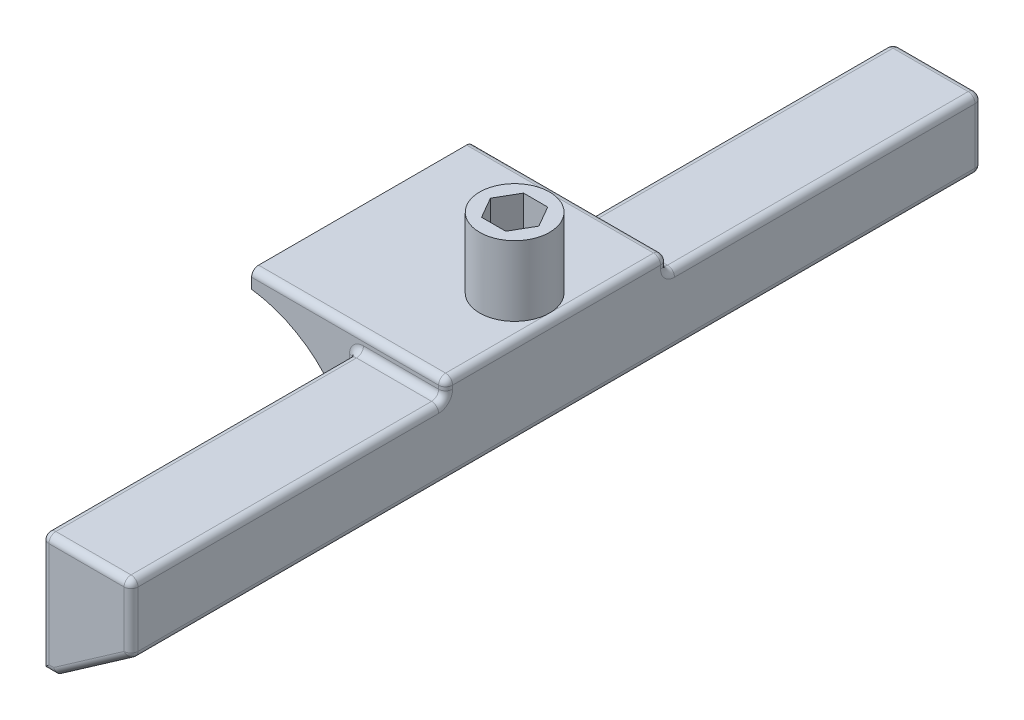
from build123d import *

# Parameters (mm, degrees)
SKETCH1_W                         = 25.5
SKETCH1_H                         = 243.5
SKETCH1_W_2                       = 17.5
SKETCH1_H_2                       = 235.5
MOTOR_PANEL_CONNECTOR_DEPTH       = 34
SKETCH3_W                         = 25.5
SKETCH3_H                         = 243.5
MOTOR_PANEL_CONNECCTOR_BASE_DEPTH = 4
UP_DOWN_CONNECT_CUT_DEPTH         = 250
SKETCH5_W                         = 47.5
SKETCH5_H                         = 31
CUT_TO_NAIL_PART_DEPTH            = 5
SKETCH6_W                         = 55.5
SKETCH6_H                         = 63.5
PANEL_CONNECTOR_DEPTH             = 5
SKETCH7_R                         = 10
BOSS_EXTRUDE4_DEPTH               = 20
BOSS_EXTRUDE5_DEPTH               = 5
BOSS_EXTRUDE6_DEPTH               = 5
FILLET1_R                         = 2


with BuildPart() as part:
    # Sketch1 → motor -panel connector (new body)
    with BuildSketch(Plane(origin=(0, 0, 0), x_dir=(1, 0, 0), z_dir=(0, 1, 0))):
        with Locations((8.75, -117.75)):
            Rectangle(SKETCH1_W, SKETCH1_H)
        with Locations((8.75, -117.75)):
            Rectangle(SKETCH1_W_2, SKETCH1_H_2, mode=Mode.SUBTRACT)
    extrude(amount=MOTOR_PANEL_CONNECTOR_DEPTH)

    # Sketch3 → motor-panel connecctor base (add)
    with BuildSketch(Plane(origin=(0, 34, 0), x_dir=(1, 0, 0), z_dir=(0, 1, 0))):
        with Locations((8.75, -117.75)):
            Rectangle(SKETCH3_W, SKETCH3_H)
    extrude(amount=-MOTOR_PANEL_CONNECCTOR_BASE_DEPTH)

    # Sketch4 → up down connect cut (cut)
    with BuildSketch(Plane.XY.offset(239.5)):
        Polygon((0, 0), (21.5, 15), (21.5, 0), align=None)
    extrude(amount=-UP_DOWN_CONNECT_CUT_DEPTH, mode=Mode.SUBTRACT)

    # Sketch5 → cut to nail part (cut)
    with BuildSketch(Plane.ZY.offset(4)):
        with Locations((117.75, 15.5)):
            Rectangle(SKETCH5_W, SKETCH5_H)
    extrude(amount=-CUT_TO_NAIL_PART_DEPTH, mode=Mode.SUBTRACT)

    # Sketch6 → panel connector (add)
    with BuildSketch(Plane(origin=(0, 34, 0), x_dir=(1, 0, 0), z_dir=(0, 1, 0))):
        with Locations((-6.25, -117.75)):
            Rectangle(SKETCH6_W, SKETCH6_H)
    extrude(amount=PANEL_CONNECTOR_DEPTH)

    # Sketch7 → Boss-Extrude4 (add)
    with BuildSketch(Plane(origin=(0, 39, 0), x_dir=(1, 0, 0), z_dir=(0, 1, 0))):
        with Locations(Location((9.5, -117.75, 0), (0, 0, 90))):
            Circle(SKETCH7_R)
        Polygon((12.964101615, -123.75), (16.42820323, -117.75), (12.964101615, -111.75), (6.035898385, -111.75), (2.57179677, -117.75), (6.035898385, -123.75), align=None, mode=Mode.SUBTRACT)
    extrude(amount=BOSS_EXTRUDE4_DEPTH)

    # Sketch8 → Boss-Extrude5 (add)
    with BuildSketch(Plane.XY.offset(149.5)):
        with BuildLine():
            Line((-34, 34), (-4, 34))
            Line((-4, 34), (-4, 0))
            ThreePointArc((-4, 0), (-12.572222823, 22.671568098), (-34, 34))
        make_face()
    extrude(amount=-BOSS_EXTRUDE5_DEPTH)

    # Sketch13 → Boss-Extrude6 (add)
    with BuildSketch(Plane(origin=(0, 0, 86), x_dir=(-1, 0, 0), z_dir=(0, 0, -1))):
        with BuildLine():
            Line((4, 0), (4, 34))
            Line((4, 34), (34, 34))
            ThreePointArc((34, 34), (12.941232514, 22.345971311), (4, 0))
        make_face()
    extrude(amount=-BOSS_EXTRUDE6_DEPTH)

    # Fillet1
    # the kernel refuses this fillet: 2 mm, written as the material it takes off along each edge
    with BuildSketch(Plane(origin=(-2, 32, 237.5), x_dir=(0, 1, 0), z_dir=(-1, 0, 0))) as fillet1_piece_1_section:
        Polygon((0, 0), (FILLET1_R * 1.02, 0), (FILLET1_R * 1.02, -FILLET1_R * 1.02), (0, -FILLET1_R * 1.02), align=None)
    fillet1_piece_1 = extrude(amount=FILLET1_R * 1.02, mode=Mode.PRIVATE)
    fillet1_piece_1 = fillet1_piece_1 - Plane(origin=(-2, 32, 237.5), x_dir=(0, -0.7071067811865475, -0.7071067811865475), z_dir=(-1, 0, 0)) * Sphere(FILLET1_R, mode=Mode.PRIVATE)
    add(fillet1_piece_1, mode=Mode.SUBTRACT)
    with BuildSketch(Plane(origin=(-2, 32, -2), x_dir=(0, 1, 0), z_dir=(-1, 0, 0))) as fillet1_piece_2_section:
        Polygon((0, 0), (FILLET1_R * 1.02, 0), (FILLET1_R * 1.02, FILLET1_R * 1.02), (0, FILLET1_R * 1.02), align=None)
    fillet1_piece_2 = extrude(amount=FILLET1_R * 1.02, mode=Mode.PRIVATE)
    fillet1_piece_2 = fillet1_piece_2 - Plane(origin=(-2, 32, -2), x_dir=(0, -0.7071067811865475, 0.7071067811865475), z_dir=(-1, 0, 0)) * Sphere(FILLET1_R, mode=Mode.PRIVATE)
    add(fillet1_piece_2, mode=Mode.SUBTRACT)
    with BuildSketch(Plane(origin=(19.5, 16.043297996, 237.5), x_dir=(0.5721815960240814, -0.8201269543011832, 0), z_dir=(0, 0, 1))) as fillet1_piece_3_section:
        Polygon((0, 0), (FILLET1_R * 1.02, 0), (FILLET1_R * 1.02, FILLET1_R * 0.532081978), (FILLET1_R * 0.583625227945, FILLET1_R * 0.836529493387), align=None)
    fillet1_piece_3 = extrude(amount=FILLET1_R * 1.02, mode=Mode.PRIVATE)
    fillet1_piece_3 = fillet1_piece_3 - Plane(origin=(19.5, 16.043297996, 237.5), x_dir=(-0.886617616569872, 0.4625031913273241, 0), z_dir=(0, 0, 1)) * Sphere(FILLET1_R, mode=Mode.PRIVATE)
    add(fillet1_piece_3, mode=Mode.SUBTRACT)
    with BuildSketch(Plane(origin=(19.5, 16.043297996, -2), x_dir=(0.5721815960240814, -0.8201269543011832, 0), z_dir=(0, 0, -1))) as fillet1_piece_4_section:
        Polygon((0, 0), (FILLET1_R * 1.02, 0), (FILLET1_R * 1.02, -FILLET1_R * 0.532081978), (FILLET1_R * 0.583625227945, -FILLET1_R * 0.836529493387), align=None)
    fillet1_piece_4 = extrude(amount=FILLET1_R * 1.02, mode=Mode.PRIVATE)
    fillet1_piece_4 = fillet1_piece_4 - Plane(origin=(19.5, 16.043297996, -2), x_dir=(-0.886617616569872, 0.4625031913273241, 0), z_dir=(0, 0, -1)) * Sphere(FILLET1_R, mode=Mode.PRIVATE)
    add(fillet1_piece_4, mode=Mode.SUBTRACT)
    with BuildSketch(Plane(origin=(21.5, 39, 154.5), x_dir=(0, -1, 0), z_dir=(0, 0, -1))) as fillet1_piece_5:
        with BuildLine():
            CenterArc((FILLET1_R, FILLET1_R), FILLET1_R, 180, 90)
            Line((0, FILLET1_R), (0, 0))
            Line((0, 0), (FILLET1_R, 0))
        make_face()
    extrude(amount=73.5, mode=Mode.SUBTRACT)
    with BuildSketch(Plane(origin=(26.5, 39, 86), x_dir=(0, -1, 0), z_dir=(-1, 0, 0))) as fillet1_piece_6:
        with BuildLine():
            CenterArc((FILLET1_R, FILLET1_R), FILLET1_R, 180, 90)
            Line((0, FILLET1_R), (0, 0))
            Line((0, 0), (FILLET1_R, 0))
        make_face()
    extrude(amount=65.5, mode=Mode.SUBTRACT)
    with BuildSketch(Plane(origin=(-39, 39, 149.5), x_dir=(0, 0, -1), z_dir=(1, 0, 0))) as fillet1_piece_7:
        with BuildLine():
            CenterArc((FILLET1_R, -FILLET1_R), FILLET1_R, 90, 90)
            Line((0, -FILLET1_R), (0, 0))
            Line((0, 0), (FILLET1_R, 0))
        make_face()
    extrude(amount=65.5, mode=Mode.SUBTRACT)
    with BuildSketch(Plane(origin=(-2, 34, 239.5), x_dir=(0, -1, 0), z_dir=(1, 0, 0))) as fillet1_piece_8:
        with BuildLine():
            CenterArc((FILLET1_R, FILLET1_R), FILLET1_R, 180, 90)
            Line((0, FILLET1_R), (0, 0))
            Line((0, 0), (FILLET1_R, 0))
        make_face()
    extrude(amount=28.5, mode=Mode.SUBTRACT)
    with BuildSketch(Plane(origin=(26.5, 34, -4), x_dir=(0, 0, 1), z_dir=(-1, 0, 0))) as fillet1_piece_9:
        with BuildLine():
            CenterArc((FILLET1_R, -FILLET1_R), FILLET1_R, 90, 90)
            Line((0, -FILLET1_R), (0, 0))
            Line((0, 0), (FILLET1_R, 0))
        make_face()
    extrude(amount=28.5, mode=Mode.SUBTRACT)
    with BuildSketch(Plane(origin=(21.5, 15, 237.5), x_dir=(-0.8201269543011818, -0.5721815960240832, 0), z_dir=(0, 0, -1))) as fillet1_piece_10:
        with BuildLine():
            CenterArc((FILLET1_R * 0.521648998039, FILLET1_R), FILLET1_R, 214.902495616, 55.097504384)
            Line((-FILLET1_R * 0.298477956262, FILLET1_R * 0.427818403976), (0, 0))
            Line((0, 0), (FILLET1_R * 0.521648998039, 0))
        make_face()
    extrude(amount=239.5, mode=Mode.SUBTRACT)
    with BuildSketch(Plane(origin=(-9, 0, 239.5), x_dir=(0, 1, 0), z_dir=(1, 0, 0))) as fillet1_piece_11:
        with BuildLine():
            CenterArc((FILLET1_R, -FILLET1_R), FILLET1_R, 90, 90)
            Line((0, -FILLET1_R), (0, 0))
            Line((0, 0), (FILLET1_R, 0))
        make_face()
    extrude(amount=14, mode=Mode.SUBTRACT)
    with BuildSketch(Plane(origin=(5, 0, -4), x_dir=(0, 0, 1), z_dir=(-1, 0, 0))) as fillet1_piece_12:
        with BuildLine():
            CenterArc((FILLET1_R, FILLET1_R), FILLET1_R, 180, 90)
            Line((0, FILLET1_R), (0, 0))
            Line((0, 0), (FILLET1_R, 0))
        make_face()
    extrude(amount=14, mode=Mode.SUBTRACT)
    with BuildSketch(Plane(origin=(-4.100634772, -2.86090798, -4), x_dir=(-0.5721815960240814, 0.8201269543011832, 0), z_dir=(0.8201269543011832, 0.5721815960240814, 0)), Plane(origin=(-4.100634772, -2.86090798, 239.5), x_dir=(0, 0, -1), z_dir=(0.8201269543011832, 0.5721815960240814, 0))) as fillet1_piece_13:
        with BuildLine():
            CenterArc((FILLET1_R, FILLET1_R), FILLET1_R, 180, 90)
            Line((0, FILLET1_R), (0, 0))
            Line((0, 0), (FILLET1_R, 0))
        make_face()
    extrude(amount=30.172155462, mode=Mode.SUBTRACT)
    with BuildSketch(Plane(origin=(21.5, 39, -4), x_dir=(-1, 0, 0), z_dir=(0, -1, 0))) as fillet1_piece_14:
        with BuildLine():
            CenterArc((FILLET1_R, -FILLET1_R), FILLET1_R, 90, 90)
            Line((0, -FILLET1_R), (0, 0))
            Line((0, 0), (FILLET1_R, 0))
        make_face()
    extrude(amount=22.956702004, mode=Mode.SUBTRACT)
    with BuildSketch(Plane(origin=(21.5, 16.043297996, 239.5), x_dir=(0, 0, -1), z_dir=(0, 1, 0))) as fillet1_piece_15:
        with BuildLine():
            CenterArc((FILLET1_R, FILLET1_R), FILLET1_R, 180, 90)
            Line((0, FILLET1_R), (0, 0))
            Line((0, 0), (FILLET1_R, 0))
        make_face()
    extrude(amount=22.956702004, mode=Mode.SUBTRACT)
    with BuildSketch(Plane(origin=(-4, -5, 239.5), x_dir=(1, 0, 0), z_dir=(0, 1, 0))) as fillet1_piece_16:
        with BuildLine():
            CenterArc((FILLET1_R, FILLET1_R), FILLET1_R, 180, 90)
            Line((0, FILLET1_R), (0, 0))
            Line((0, 0), (FILLET1_R, 0))
        make_face()
    extrude(amount=37, mode=Mode.SUBTRACT)
    with BuildSketch(Plane(origin=(-4, 32, -4), x_dir=(0, 0, 1), z_dir=(0, -1, 0))) as fillet1_piece_17:
        with BuildLine():
            CenterArc((FILLET1_R, -FILLET1_R), FILLET1_R, 90, 90)
            Line((0, -FILLET1_R), (0, 0))
            Line((0, 0), (FILLET1_R, 0))
        make_face()
    extrude(amount=37, mode=Mode.SUBTRACT)
    with BuildSketch(Plane(origin=(-4, 34, -2), x_dir=(0, -1, 0), z_dir=(0, 0, 1))) as fillet1_piece_18:
        with BuildLine():
            CenterArc((FILLET1_R, FILLET1_R), FILLET1_R, 180, 90)
            Line((0, FILLET1_R), (0, 0))
            Line((0, 0), (FILLET1_R, 0))
        make_face()
    extrude(amount=88, mode=Mode.SUBTRACT)
    with BuildSketch(Plane(origin=(-4, 34, 149.5), x_dir=(1, 0, 0), z_dir=(0, 0, 1))) as fillet1_piece_19:
        with BuildLine():
            CenterArc((FILLET1_R, -FILLET1_R), FILLET1_R, 90, 90)
            Line((0, -FILLET1_R), (0, 0))
            Line((0, 0), (FILLET1_R, 0))
        make_face()
    extrude(amount=88, mode=Mode.SUBTRACT)
    # the kernel refuses this fillet: 2 mm, written as the material it adds along each edge
    with BuildSketch(Plane(origin=(-4, 32, 149.5), x_dir=(-1, 0, 0), z_dir=(0, -1, 0))) as fillet1_2_piece_1_section:
        with BuildLine():
            CenterArc((FILLET1_R, -FILLET1_R), FILLET1_R, 90, 90)
            Line((0, -FILLET1_R), (0, 0))
            Line((0, 0), (FILLET1_R, 0))
        make_face()
    fillet1_2_piece_1 = extrude(amount=32, mode=Mode.PRIVATE)
    fillet1_2_piece_1 = fillet1_2_piece_1 - Plane(origin=(-38.266666667, 0, 149.967222139), x_dir=(1, 0, 0), z_dir=(0, 0, 1)) * Cylinder(34.266666667, 72, mode=Mode.PRIVATE)
    add(fillet1_2_piece_1)
    with BuildSketch(Plane(origin=(-4, 0, 86), x_dir=(0, 0, -1), z_dir=(0, 1, 0))) as fillet1_2_piece_2_section:
        with BuildLine():
            CenterArc((FILLET1_R, FILLET1_R), FILLET1_R, 180, 90)
            Line((0, FILLET1_R), (0, 0))
            Line((0, 0), (FILLET1_R, 0))
        make_face()
    fillet1_2_piece_2 = extrude(amount=32, mode=Mode.PRIVATE)
    fillet1_2_piece_2 = fillet1_2_piece_2 - Plane(origin=(-39.820351429, -1.370898319, 85.534344582), x_dir=(0.16236841120732118, 0.9867302058019762, 0), z_dir=(0, 0, -1)) * Cylinder(35.846574992, 73, mode=Mode.PRIVATE)
    add(fillet1_2_piece_2)
    with BuildSketch(Plane(origin=(-2, 34, 149.5), x_dir=(0, 1, 0), z_dir=(1, 0, 0)), Plane(origin=(21.5, 34, 86), x_dir=(0, 1, 0), z_dir=(-1, 0, 0))) as fillet1_2_piece_3:
        with BuildLine():
            CenterArc((FILLET1_R, FILLET1_R), FILLET1_R, 180, 90)
            Line((0, FILLET1_R), (0, 0))
            Line((0, 0), (FILLET1_R, 0))
        make_face()
    extrude(amount=23.5)
    with BuildSketch(Plane(origin=(-2, 32, 86), x_dir=(-1, 0, 0), z_dir=(0, -1, 0))) as fillet1_2_piece_4:
        with BuildLine():
            CenterArc((2 + FILLET1_R, FILLET1_R), FILLET1_R, 180, 90)
            Line((2, FILLET1_R), (2, 0))
            Line((2, 0), (2 + FILLET1_R, 0))
        make_face()
    revolve(axis=Axis((-2, 32, 86), (0, 0, -1)), revolution_arc=90)
    with BuildSketch(Plane(origin=(-2, 32, 149.5), x_dir=(0, 1, 0), z_dir=(1, 0, 0))) as fillet1_2_piece_5:
        with BuildLine():
            CenterArc((2 + FILLET1_R, FILLET1_R), FILLET1_R, 180, 90)
            Line((2, FILLET1_R), (2, 0))
            Line((2, 0), (2 + FILLET1_R, 0))
        make_face()
    revolve(axis=Axis((-2, 32, 149.5), (0, 0, 1)), revolution_arc=90)
    # the kernel refuses this fillet: 2 mm, written as the material it takes off along each edge
    with BuildSketch(Plane(origin=(19.5, 37, 88), x_dir=(0, 0, -1), z_dir=(1, 0, 0))) as fillet1_3_piece_1_section:
        Polygon((0, 0), (FILLET1_R * 1.02, 0), (FILLET1_R * 1.02, FILLET1_R * 1.02), (0, FILLET1_R * 1.02), align=None)
    fillet1_3_piece_1 = extrude(amount=FILLET1_R * 1.02, mode=Mode.PRIVATE)
    fillet1_3_piece_1 = fillet1_3_piece_1 - Plane(origin=(19.5, 37, 88), x_dir=(0, -0.7071067811865475, 0.7071067811865475), z_dir=(1, 0, 0)) * Sphere(FILLET1_R, mode=Mode.PRIVATE)
    add(fillet1_3_piece_1, mode=Mode.SUBTRACT)
    with BuildSketch(Plane(origin=(19.5, 37, 147.5), x_dir=(0, 0, 1), z_dir=(1, 0, 0))) as fillet1_3_piece_2_section:
        Polygon((0, 0), (FILLET1_R * 1.02, 0), (FILLET1_R * 1.02, -FILLET1_R * 1.02), (0, -FILLET1_R * 1.02), align=None)
    fillet1_3_piece_2 = extrude(amount=FILLET1_R * 1.02, mode=Mode.PRIVATE)
    fillet1_3_piece_2 = fillet1_3_piece_2 - Plane(origin=(19.5, 37, 147.5), x_dir=(0, -0.7071067811865475, -0.7071067811865475), z_dir=(1, 0, 0)) * Sphere(FILLET1_R, mode=Mode.PRIVATE)
    add(fillet1_3_piece_2, mode=Mode.SUBTRACT)
    with BuildSketch(Plane(origin=(19.5, 32, -2), x_dir=(0, 1, 0), z_dir=(1, 0, 0))) as fillet1_3_piece_3_section:
        Polygon((0, 0), (FILLET1_R * 1.02, 0), (FILLET1_R * 1.02, -FILLET1_R * 1.02), (0, -FILLET1_R * 1.02), align=None)
    fillet1_3_piece_3 = extrude(amount=FILLET1_R * 1.02, mode=Mode.PRIVATE)
    fillet1_3_piece_3 = fillet1_3_piece_3 - Plane(origin=(19.5, 32, -2), x_dir=(0, -0.7071067811865475, 0.7071067811865475), z_dir=(1, 0, 0)) * Sphere(FILLET1_R, mode=Mode.PRIVATE)
    add(fillet1_3_piece_3, mode=Mode.SUBTRACT)
    with BuildSketch(Plane(origin=(19.5, 32, 237.5), x_dir=(0, 1, 0), z_dir=(1, 0, 0))) as fillet1_3_piece_4_section:
        Polygon((0, 0), (FILLET1_R * 1.02, 0), (FILLET1_R * 1.02, FILLET1_R * 1.02), (0, FILLET1_R * 1.02), align=None)
    fillet1_3_piece_4 = extrude(amount=FILLET1_R * 1.02, mode=Mode.PRIVATE)
    fillet1_3_piece_4 = fillet1_3_piece_4 - Plane(origin=(19.5, 32, 237.5), x_dir=(0, -0.7071067811865475, -0.7071067811865475), z_dir=(1, 0, 0)) * Sphere(FILLET1_R, mode=Mode.PRIVATE)
    add(fillet1_3_piece_4, mode=Mode.SUBTRACT)
    with BuildSketch(Plane(origin=(21.5, 34, 237.5), x_dir=(0, -1, 0), z_dir=(0, 0, -1)), Plane(origin=(21.5, 34, 84), x_dir=(0, -1, 0), z_dir=(0, 0, -1))) as fillet1_3_piece_5:
        with BuildLine():
            CenterArc((FILLET1_R, FILLET1_R), FILLET1_R, 180, 90)
            Line((0, FILLET1_R), (0, 0))
            Line((0, 0), (FILLET1_R, 0))
        make_face()
    extrude(amount=86, mode=Mode.SUBTRACT)
    with BuildSketch(Plane(origin=(21.5, 36, 149.5), x_dir=(0, 0, -1), z_dir=(0, 1, 0))) as fillet1_3_piece_6:
        with BuildLine():
            CenterArc((FILLET1_R, FILLET1_R), FILLET1_R, 180, 90)
            Line((0, FILLET1_R), (0, 0))
            Line((0, 0), (FILLET1_R, 0))
        make_face()
    extrude(amount=1, mode=Mode.SUBTRACT)
    with BuildSketch(Plane(origin=(21.5, 36, 86), x_dir=(0, 0, 1), z_dir=(0, 1, 0))) as fillet1_3_piece_7:
        with BuildLine():
            CenterArc((FILLET1_R, -FILLET1_R), FILLET1_R, 90, 90)
            Line((0, -FILLET1_R), (0, 0))
            Line((0, 0), (FILLET1_R, 0))
        make_face()
    extrude(amount=1, mode=Mode.SUBTRACT)
    with BuildSketch(Plane(origin=(21.5, 36, 84), x_dir=(0, 0, 1), z_dir=(0, 1, 0))) as fillet1_3_piece_8:
        with BuildLine():
            CenterArc((2 + FILLET1_R, -FILLET1_R), FILLET1_R, 90, 90)
            Line((2, -FILLET1_R), (2, 0))
            Line((2, 0), (2 + FILLET1_R, 0))
        make_face()
    revolve(axis=Axis((21.5, 36, 84), (1, 0, 0)), revolution_arc=90, mode=Mode.SUBTRACT)
    with BuildSketch(Plane(origin=(21.5, 36, 151.5), x_dir=(0, 0, -1), z_dir=(0, 1, 0))) as fillet1_3_piece_9:
        with BuildLine():
            CenterArc((2 + FILLET1_R, FILLET1_R), FILLET1_R, 180, 90)
            Line((2, FILLET1_R), (2, 0))
            Line((2, 0), (2 + FILLET1_R, 0))
        make_face()
    revolve(axis=Axis((21.5, 36, 151.5), (-1, 0, 0)), revolution_arc=90, mode=Mode.SUBTRACT)


solid = part.part
